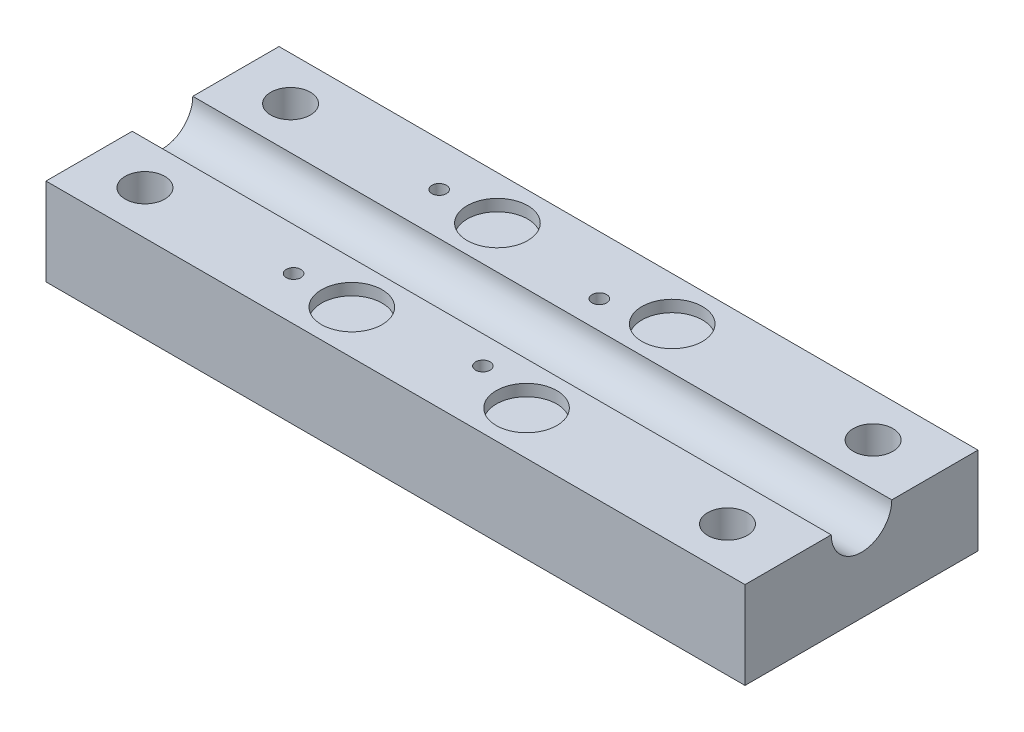
from build123d import *

# Parameters (mm, degrees)
SKETCH1_W           = 76.2
SKETCH1_H           = 25.4
BOSS_EXTRUDE1_DEPTH = 9.525
SKETCH2_R           = 2.159
CUT_EXTRUDE1_DEPTH  = 42.275
SKETCH3_R           = 3.302
CUT_EXTRUDE2_DEPTH  = 1.27
SKETCH4_R           = 0.79375
CUT_EXTRUDE3_DEPTH  = 42.275
SKETCH5_R           = 3.302
CUT_EXTRUDE4_DEPTH  = 78.836081768


with BuildPart() as part:
    # Sketch1 → Boss-Extrude1 (new body)
    with BuildSketch(Plane(origin=(0, 0, 0), x_dir=(1, 0, 0), z_dir=(0, 1, 0))):
        Rectangle(SKETCH1_W, SKETCH1_H)
    extrude(amount=BOSS_EXTRUDE1_DEPTH)

    # Sketch2 → Cut-Extrude1 (cut, through all)
    with BuildSketch(Plane(origin=(0, 9.525, 0), x_dir=(1, 0, 0), z_dir=(0, 1, 0))):
        with Locations((-32.074075882, 7.9375)):
            Circle(SKETCH2_R)
        with Locations((-32.074075882, -7.9375)):
            Circle(SKETCH2_R)
        with Locations((31.425924118, 7.9375)):
            Circle(SKETCH2_R)
        with Locations((31.425924118, -7.9375)):
            Circle(SKETCH2_R)
    extrude(amount=-CUT_EXTRUDE1_DEPTH, mode=Mode.SUBTRACT)

    # Sketch3 → Cut-Extrude2 (cut)
    with BuildSketch(Plane(origin=(0, 9.525, 0), x_dir=(1, 0, 0), z_dir=(0, 1, 0))):
        with Locations((-9.525, 7.9375)):
            Circle(SKETCH3_R)
        with Locations((-9.525, -7.9375)):
            Circle(SKETCH3_R)
        with Locations((9.525, -7.9375)):
            Circle(SKETCH3_R)
        with Locations((9.525, 7.9375)):
            Circle(SKETCH3_R)
    extrude(amount=-CUT_EXTRUDE2_DEPTH, mode=Mode.SUBTRACT)

    # Sketch4 → Cut-Extrude3 (cut, through all)
    with BuildSketch(Plane(origin=(0, 9.525, 0), x_dir=(1, 0, 0), z_dir=(0, 1, 0))):
        with Locations((-15.875, 7.9375)):
            Circle(SKETCH4_R)
        with Locations((-15.875, -7.9375)):
            Circle(SKETCH4_R)
        with Locations((3.175, 6.35)):
            Circle(SKETCH4_R)
        with Locations((3.175, -6.35)):
            Circle(SKETCH4_R)
    extrude(amount=-CUT_EXTRUDE3_DEPTH, mode=Mode.SUBTRACT)

    # Sketch5 → Cut-Extrude4 (cut, through all)
    with BuildSketch(Plane.ZY.offset(38.1)):
        with Locations((0, 9.525)):
            Circle(SKETCH5_R)
    extrude(amount=-CUT_EXTRUDE4_DEPTH, mode=Mode.SUBTRACT)


solid = part.part
